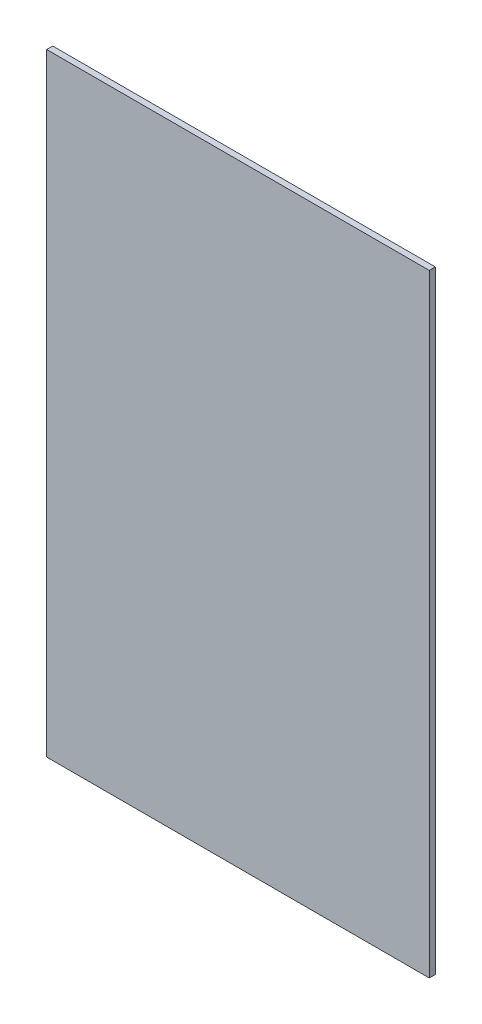
from build123d import *

# Parameters (mm, degrees)
SKETCH_1_W      = 632.3
SKETCH_1_H      = 1012.57
EXTRUDE_1_DEPTH = 10


with BuildPart() as part:
    # Эскиз1 → Бобышка-Вытянуть1 (new body)
    with BuildSketch(Plane.XY):
        with Locations((-846.15, 0)):
            Rectangle(SKETCH_1_W, SKETCH_1_H)
    extrude(amount=-EXTRUDE_1_DEPTH)


solid = part.part
